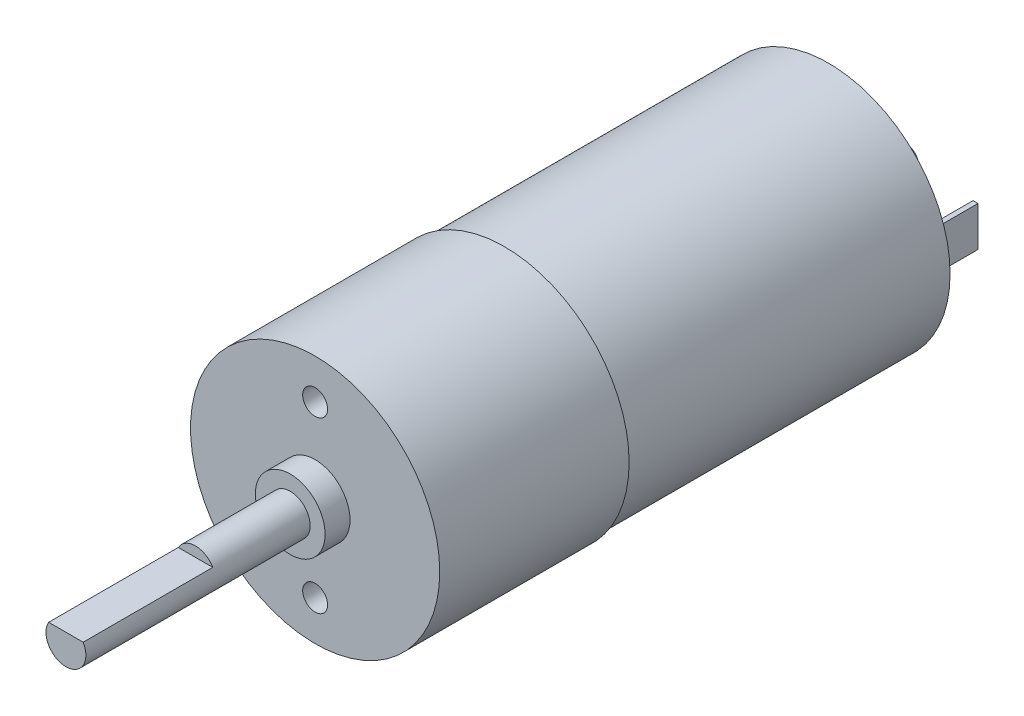
from build123d import *

# Parameters (mm, degrees)
SKETCH_1_R          = 12.5
EXTRUDE_1_DEPTH     = 19
SKETCH_2_R          = 3.5
EXTRUDE_2_DEPTH     = 2.5
SKETCH_3_R          = 2
EXTRUDE_3_DEPTH     = 22.5
SKETCH_4_W          = 6.562487183
SKETCH_4_H          = 1.182107807
CUT_EXTRUDE_1_DEPTH = 13
SKETCH_5_R          = 12.2
EXTRUDE_5_DEPTH     = 32.5
EXTRUDE_START       = 3
SKETCH_6_R          = 3.5
EXTRUDE_6_DEPTH     = 3
SKETCH_7_R          = 1
EXTRUDE_7_DEPTH     = 5
SKETCH_8_R          = 1.25
CUT_EXTRUDE_2_DEPTH = 5
SKETCH_9_W          = 0.5
SKETCH_9_H          = 4
EXTRUDE_8_DEPTH     = 5.5


with BuildPart() as part:
    # 스케치1 → 보스-돌출1 (new body)
    with BuildSketch(Plane.XY):
        Circle(SKETCH_1_R)
    extrude(amount=EXTRUDE_1_DEPTH)

    # 스케치2 → 보스-돌출2 (add)
    with BuildSketch(Plane.XY.offset(19)):
        Circle(SKETCH_2_R)
    extrude(amount=EXTRUDE_2_DEPTH)

    # 스케치3 → 보스-돌출3 (add)
    with BuildSketch(Plane.XY.offset(21.5)):
        Circle(SKETCH_3_R)
    extrude(amount=EXTRUDE_3_DEPTH)

    # 스케치4 → 컷-돌출1 (cut)
    with BuildSketch(Plane.XY.offset(44)):
        with Locations((0.048491285, 1.591053903)):
            Rectangle(SKETCH_4_W, SKETCH_4_H)
    extrude(amount=-CUT_EXTRUDE_1_DEPTH, mode=Mode.SUBTRACT)

    # 스케치5 → 보스-돌출5 (add)
    with BuildSketch(Plane(origin=(0, 0, 0), x_dir=(-1, 0, 0), z_dir=(0, 0, -1))):
        Circle(SKETCH_5_R)
    extrude(amount=EXTRUDE_5_DEPTH)

    # 스케치6 → 보스-돌출6 (add)
    with BuildSketch(Plane(origin=(0, 0, -32.5), x_dir=(-1, 0, 0), z_dir=(0, 0, -1)).offset(EXTRUDE_START)):
        Circle(SKETCH_6_R)
    extrude(amount=-EXTRUDE_6_DEPTH)

    # 스케치7 → 보스-돌출7 (add)
    with BuildSketch(Plane(origin=(0, 0, -35.5), x_dir=(-1, 0, 0), z_dir=(0, 0, -1))):
        Circle(SKETCH_7_R)
    extrude(amount=EXTRUDE_7_DEPTH)

    # 스케치8 → 컷-돌출2 (cut)
    with BuildSketch(Plane.XY.offset(19)):
        with Locations((0, 8.5)):
            Circle(SKETCH_8_R)
        with Locations((0, -8.5)):
            Circle(SKETCH_8_R)
    extrude(amount=-CUT_EXTRUDE_2_DEPTH, mode=Mode.SUBTRACT)

    # 스케치9 → 보스-돌출8 (add)
    with BuildSketch(Plane(origin=(0, 0, -32.5), x_dir=(-1, 0, 0), z_dir=(0, 0, -1))):
        with Locations((-9.25, 0)):
            Rectangle(SKETCH_9_W, SKETCH_9_H)
        with Locations((9.25, 0)):
            Rectangle(SKETCH_9_W, SKETCH_9_H)
    extrude(amount=EXTRUDE_8_DEPTH)


solid = part.part
